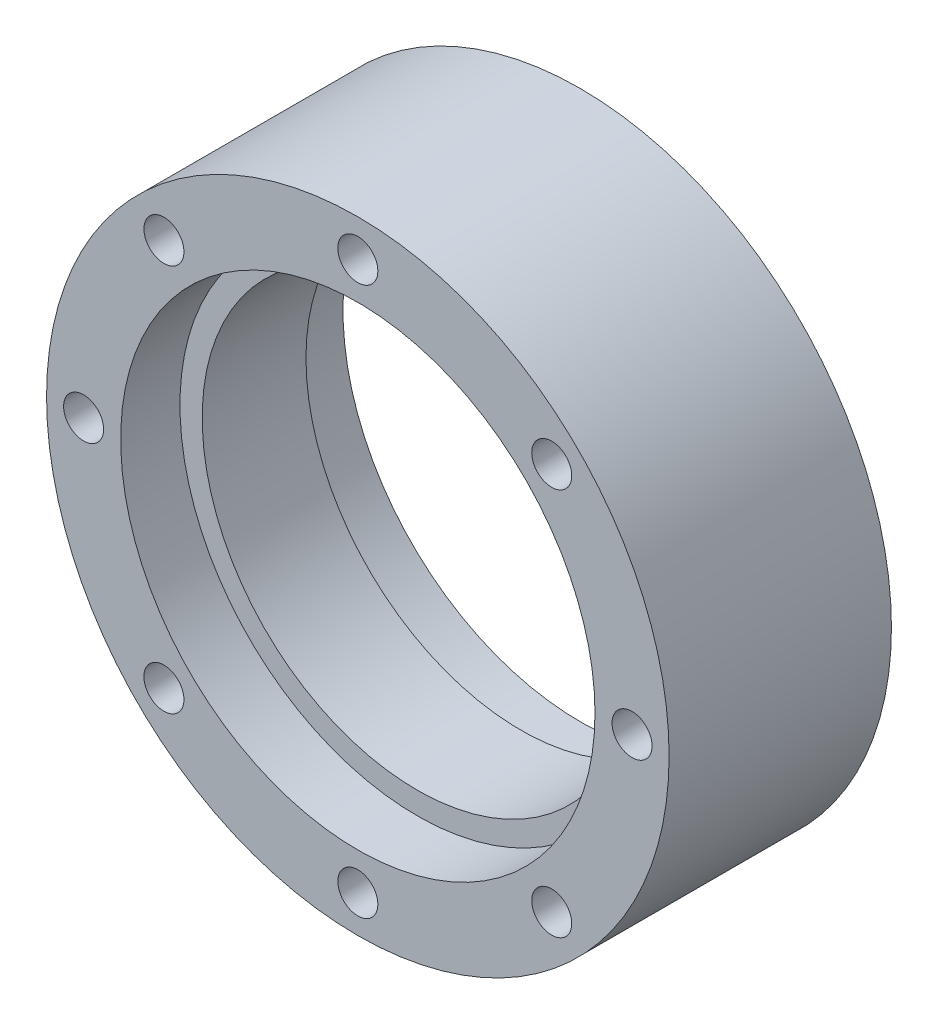
from build123d import *

# Parameters (mm, degrees)
MAINBODY_DEPTH               = 7.5
MAINBODY_DEPTH_BACK          = 7.5
SKETCH1_R                    = 21
SKETCH1_R_2                  = 14.5
SKETCH2_R                    = 16
CUT_EXTRUDE1_DEPTH           = 4
SKETCH3_R                    = 1.35
CUT_EXTRUDE2_DEPTH           = 31.630866785
CUT_EXTRUDE4_START           = -2.5
SKETCH4_R                    = 2.25
CUT_EXTRUDE4_DEPTH           = 36.771609519
CHAMFER1_SIZE                = 0.1
CIRPATTERN1_COUNT            = 4
CHAMFER1_OF_CIRPATTERN1_SIZE = 0.1
CIRPATTERN2_COUNT            = 8


with BuildPart() as part:
    # Sketch1 → MainBody (new, two sides: drawn at the far end of the back side and taken through both)
    with BuildSketch(Plane.XY.offset(-MAINBODY_DEPTH_BACK)):
        Circle(SKETCH1_R)
        Circle(SKETCH1_R_2, mode=Mode.SUBTRACT)
    extrude(amount=MAINBODY_DEPTH + MAINBODY_DEPTH_BACK)

    # Sketch2 → Cut-Extrude1 (cut)
    with BuildSketch(Plane.XY.offset(7.5)):
        Circle(SKETCH2_R)
    cut_extrude1 = extrude(amount=-CUT_EXTRUDE1_DEPTH, mode=Mode.SUBTRACT)

    # Mirror1: Cut-Extrude1 across plane
    add(cut_extrude1.mirror(Plane.XY), mode=Mode.SUBTRACT)

    # Sketch3 → Cut-Extrude2 (cut, symmetric)
    with BuildSketch(Plane.XY):
        with Locations((0, 18.5)):
            Circle(SKETCH3_R)
    cut_extrude2 = extrude(amount=CUT_EXTRUDE2_DEPTH, both=True, mode=Mode.SUBTRACT)

    # Sketch4 → Cut-Extrude4 (cut)
    with BuildSketch(Plane(origin=(0, 0, -7.5), x_dir=(-1, 0, 0), z_dir=(0, 0, -1)).offset(CUT_EXTRUDE4_START)):
        with Locations((0, 18.5)):
            Circle(SKETCH4_R)
    cut_extrude4 = extrude(amount=CUT_EXTRUDE4_DEPTH, mode=Mode.SUBTRACT)

    # Chamfer1
    chamfer1_edges = [part.edges().sort_by_distance(p)[0] for p in [
        (-1.35, 18.5, -5),
    ]]
    chamfer(chamfer1_edges, length=CHAMFER1_SIZE)

    # CirPattern1: Cut-Extrude2, Cut-Extrude4 ×4 about axis
    cirpattern1_axis = Axis((0, 0, 8.25), (0, 0, -1))
    add([cut_extrude2.rotate(cirpattern1_axis, i * 360 / CIRPATTERN1_COUNT) for i in range(1, CIRPATTERN1_COUNT)], mode=Mode.SUBTRACT)
    add([cut_extrude4.rotate(cirpattern1_axis, i * 360 / CIRPATTERN1_COUNT) for i in range(1, CIRPATTERN1_COUNT)], mode=Mode.SUBTRACT)

    # Chamfer1 of CirPattern1
    chamfer1_of_cirpattern1_edges = [part.edges().sort_by_distance(p)[0] for p in [
        (18.5, 1.35, -5),
        (1.35, -18.5, -5),
        (-18.5, -1.35, -5),
    ]]
    chamfer(chamfer1_of_cirpattern1_edges, length=CHAMFER1_OF_CIRPATTERN1_SIZE)

    # CirPattern2: Cut-Extrude2 ×8 about axis
    cirpattern2_axis = Axis((0, 0, 8.25), (0, 0, -1))
    for i in range(1, CIRPATTERN2_COUNT):
        add(cut_extrude2.rotate(cirpattern2_axis, i * 360 / CIRPATTERN2_COUNT), mode=Mode.SUBTRACT)


solid = part.part
